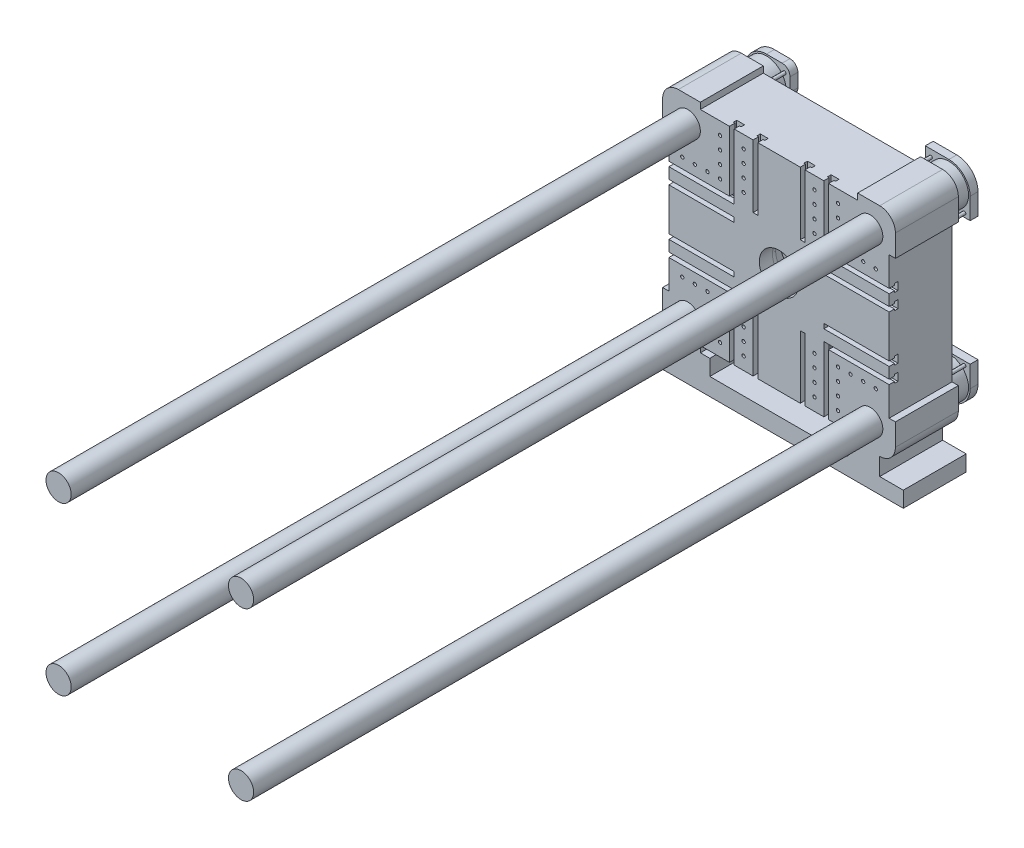
from build123d import *

# Parameters (mm, degrees)
SKETCH1_W                        = 1400
SKETCH1_H                        = 1300
BOSS_EXTRUDE1_DEPTH              = 400
SKETCH2_R                        = 80
BOSS_EXTRUDE2_DEPTH              = 4000
BOSS_EXTRUDE3_DEPTH              = 400
FILLET1_R                        = 100
FILLET1_OF_MIRROR1_R             = 100
MIRROR2_DEPTH                    = 400
SKETCH5_R                        = 125
CUT_EXTRUDE1_DEPTH               = 100
FILLET2_R                        = 50
CUT_EXTRUDE2_DEPTH               = 400
MIRROR4_COPY_1_DEPTH             = 400
CUT_EXTRUDE3_REACH               = 4682.78
FILLET3_R                        = 10
CUT_EXTRUDE4_DEPTH               = 415
CUT_EXTRUDE5_START               = -415
CUT_EXTRUDE5_DEPTH               = 415
CIRPATTERN1_COUNT                = 2
CIRPATTERN1_START                = -415
CIRPATTERN1_COPY_1_DEPTH         = 415
M24X3_0_TAPPED_HOLE1_AT_2_COUNT  = 2
M24X3_0_TAPPED_HOLE1_AT_2_PITCH  = 80
M24X3_0_TAPPED_HOLE1_AT_3_COUNT  = 2
M24X3_0_TAPPED_HOLE1_AT_3_PITCH  = 160
M24X3_0_TAPPED_HOLE1_AT_4_COUNT  = 2
M24X3_0_TAPPED_HOLE1_AT_4_PITCH  = 240
M24X3_0_TAPPED_HOLE1_AT_5_COUNT  = 2
M24X3_0_TAPPED_HOLE1_AT_5_PITCH  = 283.019433962
M24X3_0_TAPPED_HOLE1_AT_6_COUNT  = 2
M24X3_0_TAPPED_HOLE1_AT_6_PITCH  = 219.317121995
M24X3_0_TAPPED_HOLE1_AT_7_COUNT  = 2
M24X3_0_TAPPED_HOLE1_AT_7_PITCH  = 170
M24X3_0_TAPPED_HOLE1_AT_8_COUNT  = 2
M24X3_0_TAPPED_HOLE1_AT_8_PITCH  = 150
M24X3_0_TAPPED_HOLE1_AT_9_COUNT  = 2
M24X3_0_TAPPED_HOLE1_AT_9_PITCH  = 230
M24X3_0_TAPPED_HOLE1_AT_10_COUNT = 2
M24X3_0_TAPPED_HOLE1_AT_10_PITCH = 310
M24X3_0_TAPPED_HOLE1_AT_11_COUNT = 2
M24X3_0_TAPPED_HOLE1_AT_11_PITCH = 390
SKETCH15_R                       = 80
CUT_EXTRUDE6_DEPTH               = 5025
SKETCH16_R                       = 80
BOSS_EXTRUDE4_DEPTH              = 4000
BOSS_EXTRUDE4_2_DEPTH            = 4000
BOSS_EXTRUDE4_3_DEPTH            = 4000
BOSS_EXTRUDE4_4_DEPTH            = 4000
SKETCH17_R                       = 125
BOSS_EXTRUDE5_DEPTH              = 100
BOSS_EXTRUDE6_DEPTH              = 50
FILLET4_R                        = 50
SKETCH19_R                       = 10
BOSS_EXTRUDE7_DEPTH              = 222
MIRROR25_COPY_1_DEPTH            = 50
MIRROR25_COPY_2_SKETCH_R         = 10
MIRROR25_COPY_2_DEPTH            = 222
SKETCH20_W                       = 1280
SKETCH20_H                       = 400
BOSS_EXTRUDE8_DEPTH              = 211
SKETCH21_W                       = 880
SKETCH21_H                       = 100
CUT_EXTRUDE7_DEPTH               = 7314
SKETCH22_W                       = 150
SKETCH22_H                       = 100
BOSS_EXTRUDE9_DEPTH              = 400


# Read off the part's stored shape, not the designer's step: Mirror2
with BuildPart() as part:
    # Sketch1 → Boss-Extrude1 (new body)
    with BuildSketch(Plane.XY):
        Rectangle(SKETCH1_W, SKETCH1_H)
    extrude(amount=BOSS_EXTRUDE1_DEPTH)

    # Sketch2 → Boss-Extrude2 (add)
    with BuildSketch(Plane.XY.offset(400)):
        with Locations(Location((-550, 450, 0), (0, 0, 180))):
            Circle(SKETCH2_R)
        with Locations(Location((550, 450, 0), (0, 0, 180))):
            Circle(SKETCH2_R)
        with Locations(Location((550, -450, 0), (0, 0, 180))):
            Circle(SKETCH2_R)
        with Locations(Location((-550, -450, 0), (0, 0, 180))):
            Circle(SKETCH2_R)
    extrude(amount=BOSS_EXTRUDE2_DEPTH)

    # Sketch3 → Boss-Extrude3 (add)
    with BuildSketch(Plane(origin=(0, 0, 0), x_dir=(-1, 0, 0), z_dir=(0, 0, -1))):
        Polygon((-700, 650), (-500, 650), (-500, 690), (-740, 690), (-740, 450), (-700, 450), align=None)
    boss_extrude3 = extrude(amount=-BOSS_EXTRUDE3_DEPTH)

    # Fillet1
    fillet1_edges = [part.edges().sort_by_distance(p)[0] for p in [
        (740, 690, 200),
    ]]
    fillet(fillet1_edges, radius=FILLET1_R)

    # Mirror1: Boss-Extrude3 across plane
    add(boss_extrude3.mirror(Plane(origin=(0, 0, 0), x_dir=(0, 0, 1), z_dir=(1, 0, 0))))

    # Fillet1 of Mirror1
    fillet1_of_mirror1_edges = [part.edges().sort_by_distance(p)[0] for p in [
        (-740, 690, 200),
    ]]
    fillet(fillet1_of_mirror1_edges, radius=FILLET1_OF_MIRROR1_R)

    # Mirror2 outline → Mirror2 (add)
    with BuildSketch(Plane.XY):
        with BuildLine():
            Line((-500, -690), (-500, -650))
            Line((-500, -650), (-700, -650))
            Line((-700, -650), (-700, -450))
            Line((-700, -450), (-740, -450))
            Line((-740, -450), (-740, -590))
            ThreePointArc((-740, -590), (-710.710678119, -660.710678119), (-640, -690))
            Line((-640, -690), (-500, -690))
        make_face()
        with BuildLine():
            Line((740, -590), (740, -450))
            Line((740, -450), (700, -450))
            Line((700, -450), (700, -650))
            Line((700, -650), (500, -650))
            Line((500, -650), (500, -690))
            Line((500, -690), (640, -690))
            ThreePointArc((640, -690), (710.710678119, -660.710678119), (740, -590))
        make_face()
    extrude(amount=MIRROR2_DEPTH)

    # Sketch5 → Cut-Extrude1 (cut)
    with BuildSketch(Plane.XY.offset(400)):
        Circle(SKETCH5_R)
    extrude(amount=-CUT_EXTRUDE1_DEPTH, mode=Mode.SUBTRACT)

    # Sketch6 → Cut-Revolve1 (revolve, cut)
    with BuildSketch(Plane(origin=(0, 0, 0), x_dir=(1, 0, 0), z_dir=(0, 1, 0))):
        Polygon((0, -300), (0, 0), (200, 0), (200, -200), (125, -300), align=None)
    revolve(axis=Axis((0, 0, 300), (0, 0, -1)), mode=Mode.SUBTRACT)

    # Fillet2
    fillet2_edges = [part.edges().sort_by_distance(p)[0] for p in [
        (-125, 0, 300),
    ]]
    fillet(fillet2_edges, radius=FILLET2_R)

    # Sketch7 → Cut-Extrude2 (cut)
    with BuildSketch(Plane.XZ.offset(650)):
        Polygon((275, 344), (325, 344), (325, 366), (315, 366), (315, 400), (285, 400), (285, 366), (275, 366), align=None)
        Polygon((125, 344), (175, 344), (175, 366), (165, 366), (165, 400), (135, 400), (135, 366), (125, 366), align=None)
    cut_extrude2 = extrude(amount=-CUT_EXTRUDE2_DEPTH, mode=Mode.SUBTRACT)

    # Mirror3: Cut-Extrude2 across plane
    add(cut_extrude2.mirror(Plane(origin=(0, 0, 0), x_dir=(0, 0, 1), z_dir=(1, 0, 0))), mode=Mode.SUBTRACT)

    # Mirror4: Cut-Extrude2 across plane
    add(cut_extrude2.mirror(Plane.ZX), mode=Mode.SUBTRACT)

    # Mirror4 copy 1 sketch → Mirror4 copy 1 (cut)
    with BuildSketch(Plane(origin=(0, 650, 0), x_dir=(-1, 0, 0), z_dir=(0, 1, 0))):
        Polygon((275, 344), (325, 344), (325, 366), (315, 366), (315, 400), (285, 400), (285, 366), (275, 366), align=None)
        Polygon((125, 344), (175, 344), (175, 366), (165, 366), (165, 400), (135, 400), (135, 366), (125, 366), align=None)
    extrude(amount=-MIRROR4_COPY_1_DEPTH, mode=Mode.SUBTRACT)

    # Cut-Extrude3: up to this face of the body (flat: up to its plane)
    cut_extrude3_end = Plane(part.part.faces().sort_by_distance((285, 450, 383))[0])
    # Sketch8 → Cut-Extrude3 (cut, up to the picked face)
    with BuildSketch(Plane(origin=(700, 0, 0), x_dir=(0, 0, -1), z_dir=(1, 0, 0)), mode=Mode.PRIVATE) as cut_extrude3_sk1:
        Polygon((-344, 275), (-344, 225), (-366, 225), (-366, 235), (-400, 235), (-400, 265), (-366, 265), (-366, 275), align=None)
    cut_extrude3_tool1 = split(extrude(cut_extrude3_sk1.sketch, amount=-CUT_EXTRUDE3_REACH, mode=Mode.PRIVATE), bisect_by=cut_extrude3_end, keep=Keep.BOTH, mode=Mode.PRIVATE)
    cut_extrude3 = cut_extrude3_tool1.solids().sort_by(Axis((700, 250, 368.471698), (-1, 0, 0)))[0]
    add(cut_extrude3, mode=Mode.SUBTRACT)

    # Fillet3
    fillet3_edges = [part.edges().sort_by_distance(p)[0] for p in [
        (315, 265, 383),
        (285, 235, 383),
    ]]
    fillet(fillet3_edges, radius=FILLET3_R)

    # Mirror5: Cut-Extrude3 across plane
    add(cut_extrude3.mirror(Plane.ZX), mode=Mode.SUBTRACT)

    # Sketch9 → Cut-Extrude4 (cut)
    with BuildSketch(Plane.ZY.offset(700)):
        Polygon((400, 265), (366, 265), (366, 275), (344, 275), (344, 225), (366, 225), (366, 235), (400, 235), align=None)
    cut_extrude4 = extrude(amount=-CUT_EXTRUDE4_DEPTH, mode=Mode.SUBTRACT)

    # Mirror12: Cut-Extrude4 across plane
    add(cut_extrude4.mirror(Plane.ZX), mode=Mode.SUBTRACT)

    # Sketch10 → Cut-Extrude5 (cut)
    with BuildSketch(Plane(origin=(700, 0, 0), x_dir=(0, 0, -1), z_dir=(1, 0, 0)).offset(CUT_EXTRUDE5_START)):
        Polygon((-344, 175), (-344, 125), (-366, 125), (-366, 135), (-400, 135), (-400, 165), (-366, 165), (-366, 175), align=None)
    cut_extrude5 = extrude(amount=CUT_EXTRUDE5_DEPTH, mode=Mode.SUBTRACT)

    # Mirror13: Cut-Extrude5 across plane
    add(cut_extrude5.mirror(Plane.ZX), mode=Mode.SUBTRACT)

    # CirPattern1: Cut-Extrude5 ×2 about axis
    cirpattern1_axis = Axis((0, 0, 0), (0, 0, 1))
    for i in range(1, CIRPATTERN1_COUNT):
        add(cut_extrude5.rotate(cirpattern1_axis, i * 360 / CIRPATTERN1_COUNT), mode=Mode.SUBTRACT)

    # CirPattern1 copy 1 sketch → CirPattern1 copy 1 (cut)
    with BuildSketch(Plane(origin=(-700, 0, 0), x_dir=(0, 0, -1), z_dir=(-1, 0, 0)).offset(CIRPATTERN1_START)):
        Polygon((-344, -175), (-344, -125), (-366, -125), (-366, -135), (-400, -135), (-400, -165), (-366, -165), (-366, -175), align=None)
    extrude(amount=CIRPATTERN1_COPY_1_DEPTH, mode=Mode.SUBTRACT)

    # Sketch14 → M24x3.0 Tapped Hole1 (revolve, cut)
    with BuildSketch(Plane(origin=(225, -330, 400), x_dir=(0, -1, 0), z_dir=(1, 0, 0))):
        Polygon((0, 0), (0, 66.3090365), (10.5, 60), (10.5, 0), align=None)
    m24x3_0_tapped_hole1 = revolve(axis=Axis((225, -330, 406.35), (0, 0, -1)), mode=Mode.SUBTRACT)

    # M24x3.0 Tapped Hole1 at 2: M24x3.0 Tapped Hole1 ×2
    with Locations(*[(0, -i * M24X3_0_TAPPED_HOLE1_AT_2_PITCH, 0) for i in range(1, M24X3_0_TAPPED_HOLE1_AT_2_COUNT)]):
        add(m24x3_0_tapped_hole1, mode=Mode.SUBTRACT)

    # M24x3.0 Tapped Hole1 at 3: M24x3.0 Tapped Hole1 ×2
    with Locations(*[(0, -i * M24X3_0_TAPPED_HOLE1_AT_3_PITCH, 0) for i in range(1, M24X3_0_TAPPED_HOLE1_AT_3_COUNT)]):
        add(m24x3_0_tapped_hole1, mode=Mode.SUBTRACT)

    # M24x3.0 Tapped Hole1 at 4: M24x3.0 Tapped Hole1 ×2
    with Locations(*[(0, -i * M24X3_0_TAPPED_HOLE1_AT_4_PITCH, 0) for i in range(1, M24X3_0_TAPPED_HOLE1_AT_4_COUNT)]):
        add(m24x3_0_tapped_hole1, mode=Mode.SUBTRACT)

    # M24x3.0 Tapped Hole1 at 5: M24x3.0 Tapped Hole1 ×2
    with Locations(*[Vector(0.5299989400031799, -0.8479983040050881, 0) * (i * M24X3_0_TAPPED_HOLE1_AT_5_PITCH) for i in range(1, M24X3_0_TAPPED_HOLE1_AT_5_COUNT)]):
        add(m24x3_0_tapped_hole1, mode=Mode.SUBTRACT)

    # M24x3.0 Tapped Hole1 at 6: M24x3.0 Tapped Hole1 ×2
    with Locations(*[Vector(0.6839411288813297, -0.7295372041400852, 0) * (i * M24X3_0_TAPPED_HOLE1_AT_6_PITCH) for i in range(1, M24X3_0_TAPPED_HOLE1_AT_6_COUNT)]):
        add(m24x3_0_tapped_hole1, mode=Mode.SUBTRACT)

    # M24x3.0 Tapped Hole1 at 7: M24x3.0 Tapped Hole1 ×2
    with Locations(*[Vector(0.8823529411764706, -0.47058823529411786, 0) * (i * M24X3_0_TAPPED_HOLE1_AT_7_PITCH) for i in range(1, M24X3_0_TAPPED_HOLE1_AT_7_COUNT)]):
        add(m24x3_0_tapped_hole1, mode=Mode.SUBTRACT)

    # M24x3.0 Tapped Hole1 at 8: M24x3.0 Tapped Hole1 ×2
    with Locations(*[(i * M24X3_0_TAPPED_HOLE1_AT_8_PITCH, 0, 0) for i in range(1, M24X3_0_TAPPED_HOLE1_AT_8_COUNT)]):
        add(m24x3_0_tapped_hole1, mode=Mode.SUBTRACT)

    # M24x3.0 Tapped Hole1 at 9: M24x3.0 Tapped Hole1 ×2
    with Locations(*[(i * M24X3_0_TAPPED_HOLE1_AT_9_PITCH, 0, 0) for i in range(1, M24X3_0_TAPPED_HOLE1_AT_9_COUNT)]):
        add(m24x3_0_tapped_hole1, mode=Mode.SUBTRACT)

    # M24x3.0 Tapped Hole1 at 10: M24x3.0 Tapped Hole1 ×2
    with Locations(*[(i * M24X3_0_TAPPED_HOLE1_AT_10_PITCH, 0, 0) for i in range(1, M24X3_0_TAPPED_HOLE1_AT_10_COUNT)]):
        add(m24x3_0_tapped_hole1, mode=Mode.SUBTRACT)

    # M24x3.0 Tapped Hole1 at 11: M24x3.0 Tapped Hole1 ×2
    with Locations(*[(i * M24X3_0_TAPPED_HOLE1_AT_11_PITCH, 0, 0) for i in range(1, M24X3_0_TAPPED_HOLE1_AT_11_COUNT)]):
        add(m24x3_0_tapped_hole1, mode=Mode.SUBTRACT)

    # Mirror22: M24x3.0 Tapped Hole1 across plane
    add(m24x3_0_tapped_hole1.mirror(Plane.ZX), mode=Mode.SUBTRACT)

    # Mirror22 copy 1 sketch → Mirror22 copy 1 (revolve, cut)
    with BuildSketch(Plane(origin=(225, 410, 400), x_dir=(0, 1, 0), z_dir=(1, 0, 0))):
        Polygon((0, 0), (0, -66.3090365), (10.5, -60), (10.5, 0), align=None)
    revolve(axis=Axis((225, 410, 406.35), (0, 0, 1)), mode=Mode.SUBTRACT)

    # Mirror22 copy 2 sketch → Mirror22 copy 2 (revolve, cut)
    with BuildSketch(Plane(origin=(225, 490, 400), x_dir=(0, 1, 0), z_dir=(1, 0, 0))):
        Polygon((0, 0), (0, -66.3090365), (10.5, -60), (10.5, 0), align=None)
    revolve(axis=Axis((225, 490, 406.35), (0, 0, 1)), mode=Mode.SUBTRACT)

    # Mirror22 copy 3 sketch → Mirror22 copy 3 (revolve, cut)
    with BuildSketch(Plane(origin=(225, 570, 400), x_dir=(0, 1, 0), z_dir=(1, 0, 0))):
        Polygon((0, 0), (0, -66.3090365), (10.5, -60), (10.5, 0), align=None)
    revolve(axis=Axis((225, 570, 406.35), (0, 0, 1)), mode=Mode.SUBTRACT)

    # Mirror22 copy 4 sketch → Mirror22 copy 4 (revolve, cut)
    with BuildSketch(Plane(origin=(375, 570, 400), x_dir=(0, 1, 0), z_dir=(1, 0, 0))):
        Polygon((0, 0), (0, -66.3090365), (10.5, -60), (10.5, 0), align=None)
    revolve(axis=Axis((375, 570, 406.35), (0, 0, 1)), mode=Mode.SUBTRACT)

    # Mirror22 copy 5 sketch → Mirror22 copy 5 (revolve, cut)
    with BuildSketch(Plane(origin=(375, 490, 400), x_dir=(0, 1, 0), z_dir=(1, 0, 0))):
        Polygon((0, 0), (0, -66.3090365), (10.5, -60), (10.5, 0), align=None)
    revolve(axis=Axis((375, 490, 406.35), (0, 0, 1)), mode=Mode.SUBTRACT)

    # Mirror22 copy 6 sketch → Mirror22 copy 6 (revolve, cut)
    with BuildSketch(Plane(origin=(375, 410, 400), x_dir=(0, 1, 0), z_dir=(1, 0, 0))):
        Polygon((0, 0), (0, -66.3090365), (10.5, -60), (10.5, 0), align=None)
    revolve(axis=Axis((375, 410, 406.35), (0, 0, 1)), mode=Mode.SUBTRACT)

    # Mirror22 copy 7 sketch → Mirror22 copy 7 (revolve, cut)
    with BuildSketch(Plane(origin=(375, 330, 400), x_dir=(0, 1, 0), z_dir=(1, 0, 0))):
        Polygon((0, 0), (0, -66.3090365), (10.5, -60), (10.5, 0), align=None)
    revolve(axis=Axis((375, 330, 406.35), (0, 0, 1)), mode=Mode.SUBTRACT)

    # Mirror22 copy 8 sketch → Mirror22 copy 8 (revolve, cut)
    with BuildSketch(Plane(origin=(455, 330, 400), x_dir=(0, 1, 0), z_dir=(1, 0, 0))):
        Polygon((0, 0), (0, -66.3090365), (10.5, -60), (10.5, 0), align=None)
    revolve(axis=Axis((455, 330, 406.35), (0, 0, 1)), mode=Mode.SUBTRACT)

    # Mirror22 copy 9 sketch → Mirror22 copy 9 (revolve, cut)
    with BuildSketch(Plane(origin=(535, 330, 400), x_dir=(0, 1, 0), z_dir=(1, 0, 0))):
        Polygon((0, 0), (0, -66.3090365), (10.5, -60), (10.5, 0), align=None)
    revolve(axis=Axis((535, 330, 406.35), (0, 0, 1)), mode=Mode.SUBTRACT)

    # Mirror22 copy 10 sketch → Mirror22 copy 10 (revolve, cut)
    with BuildSketch(Plane(origin=(615, 330, 400), x_dir=(0, 1, 0), z_dir=(1, 0, 0))):
        Polygon((0, 0), (0, -66.3090365), (10.5, -60), (10.5, 0), align=None)
    revolve(axis=Axis((615, 330, 406.35), (0, 0, 1)), mode=Mode.SUBTRACT)

    # Mirror23: M24x3.0 Tapped Hole1 across plane
    add(m24x3_0_tapped_hole1.mirror(Plane(origin=(0, 0, 0), x_dir=(0, 0, 1), z_dir=(1, 0, 0))), mode=Mode.SUBTRACT)

    # Mirror23 copy 1 sketch → Mirror23 copy 1 (revolve, cut)
    with BuildSketch(Plane(origin=(-225, -410, 400), x_dir=(0, -1, 0), z_dir=(-1, 0, 0))):
        Polygon((0, 0), (0, -66.3090365), (10.5, -60), (10.5, 0), align=None)
    revolve(axis=Axis((-225, -410, 406.35), (0, 0, 1)), mode=Mode.SUBTRACT)

    # Mirror23 copy 2 sketch → Mirror23 copy 2 (revolve, cut)
    with BuildSketch(Plane(origin=(-225, -490, 400), x_dir=(0, -1, 0), z_dir=(-1, 0, 0))):
        Polygon((0, 0), (0, -66.3090365), (10.5, -60), (10.5, 0), align=None)
    revolve(axis=Axis((-225, -490, 406.35), (0, 0, 1)), mode=Mode.SUBTRACT)

    # Mirror23 copy 3 sketch → Mirror23 copy 3 (revolve, cut)
    with BuildSketch(Plane(origin=(-225, -570, 400), x_dir=(0, -1, 0), z_dir=(-1, 0, 0))):
        Polygon((0, 0), (0, -66.3090365), (10.5, -60), (10.5, 0), align=None)
    revolve(axis=Axis((-225, -570, 406.35), (0, 0, 1)), mode=Mode.SUBTRACT)

    # Mirror23 copy 4 sketch → Mirror23 copy 4 (revolve, cut)
    with BuildSketch(Plane(origin=(-375, -570, 400), x_dir=(0, -1, 0), z_dir=(-1, 0, 0))):
        Polygon((0, 0), (0, -66.3090365), (10.5, -60), (10.5, 0), align=None)
    revolve(axis=Axis((-375, -570, 406.35), (0, 0, 1)), mode=Mode.SUBTRACT)

    # Mirror23 copy 5 sketch → Mirror23 copy 5 (revolve, cut)
    with BuildSketch(Plane(origin=(-375, -490, 400), x_dir=(0, -1, 0), z_dir=(-1, 0, 0))):
        Polygon((0, 0), (0, -66.3090365), (10.5, -60), (10.5, 0), align=None)
    revolve(axis=Axis((-375, -490, 406.35), (0, 0, 1)), mode=Mode.SUBTRACT)

    # Mirror23 copy 6 sketch → Mirror23 copy 6 (revolve, cut)
    with BuildSketch(Plane(origin=(-375, -410, 400), x_dir=(0, -1, 0), z_dir=(-1, 0, 0))):
        Polygon((0, 0), (0, -66.3090365), (10.5, -60), (10.5, 0), align=None)
    revolve(axis=Axis((-375, -410, 406.35), (0, 0, 1)), mode=Mode.SUBTRACT)

    # Mirror23 copy 7 sketch → Mirror23 copy 7 (revolve, cut)
    with BuildSketch(Plane(origin=(-375, -330, 400), x_dir=(0, -1, 0), z_dir=(-1, 0, 0))):
        Polygon((0, 0), (0, -66.3090365), (10.5, -60), (10.5, 0), align=None)
    revolve(axis=Axis((-375, -330, 406.35), (0, 0, 1)), mode=Mode.SUBTRACT)

    # Mirror23 copy 8 sketch → Mirror23 copy 8 (revolve, cut)
    with BuildSketch(Plane(origin=(-455, -330, 400), x_dir=(0, -1, 0), z_dir=(-1, 0, 0))):
        Polygon((0, 0), (0, -66.3090365), (10.5, -60), (10.5, 0), align=None)
    revolve(axis=Axis((-455, -330, 406.35), (0, 0, 1)), mode=Mode.SUBTRACT)

    # Mirror23 copy 9 sketch → Mirror23 copy 9 (revolve, cut)
    with BuildSketch(Plane(origin=(-535, -330, 400), x_dir=(0, -1, 0), z_dir=(-1, 0, 0))):
        Polygon((0, 0), (0, -66.3090365), (10.5, -60), (10.5, 0), align=None)
    revolve(axis=Axis((-535, -330, 406.35), (0, 0, 1)), mode=Mode.SUBTRACT)

    # Mirror23 copy 10 sketch → Mirror23 copy 10 (revolve, cut)
    with BuildSketch(Plane(origin=(-615, -330, 400), x_dir=(0, -1, 0), z_dir=(-1, 0, 0))):
        Polygon((0, 0), (0, -66.3090365), (10.5, -60), (10.5, 0), align=None)
    revolve(axis=Axis((-615, -330, 406.35), (0, 0, 1)), mode=Mode.SUBTRACT)

    # Mirror23 copy 11 sketch → Mirror23 copy 11 (revolve, cut)
    with BuildSketch(Plane(origin=(-225, 330, 400), x_dir=(0, 1, 0), z_dir=(-1, 0, 0))):
        Polygon((0, 0), (0, 66.3090365), (10.5, 60), (10.5, 0), align=None)
    revolve(axis=Axis((-225, 330, 406.35), (0, 0, -1)), mode=Mode.SUBTRACT)

    # Mirror23 copy 12 sketch → Mirror23 copy 12 (revolve, cut)
    with BuildSketch(Plane(origin=(-225, 410, 400), x_dir=(0, 1, 0), z_dir=(-1, 0, 0))):
        Polygon((0, 0), (0, 66.3090365), (10.5, 60), (10.5, 0), align=None)
    revolve(axis=Axis((-225, 410, 406.35), (0, 0, -1)), mode=Mode.SUBTRACT)

    # Mirror23 copy 13 sketch → Mirror23 copy 13 (revolve, cut)
    with BuildSketch(Plane(origin=(-225, 490, 400), x_dir=(0, 1, 0), z_dir=(-1, 0, 0))):
        Polygon((0, 0), (0, 66.3090365), (10.5, 60), (10.5, 0), align=None)
    revolve(axis=Axis((-225, 490, 406.35), (0, 0, -1)), mode=Mode.SUBTRACT)

    # Mirror23 copy 14 sketch → Mirror23 copy 14 (revolve, cut)
    with BuildSketch(Plane(origin=(-225, 570, 400), x_dir=(0, 1, 0), z_dir=(-1, 0, 0))):
        Polygon((0, 0), (0, 66.3090365), (10.5, 60), (10.5, 0), align=None)
    revolve(axis=Axis((-225, 570, 406.35), (0, 0, -1)), mode=Mode.SUBTRACT)

    # Mirror23 copy 15 sketch → Mirror23 copy 15 (revolve, cut)
    with BuildSketch(Plane(origin=(-375, 570, 400), x_dir=(0, 1, 0), z_dir=(-1, 0, 0))):
        Polygon((0, 0), (0, 66.3090365), (10.5, 60), (10.5, 0), align=None)
    revolve(axis=Axis((-375, 570, 406.35), (0, 0, -1)), mode=Mode.SUBTRACT)

    # Mirror23 copy 16 sketch → Mirror23 copy 16 (revolve, cut)
    with BuildSketch(Plane(origin=(-375, 490, 400), x_dir=(0, 1, 0), z_dir=(-1, 0, 0))):
        Polygon((0, 0), (0, 66.3090365), (10.5, 60), (10.5, 0), align=None)
    revolve(axis=Axis((-375, 490, 406.35), (0, 0, -1)), mode=Mode.SUBTRACT)

    # Mirror23 copy 17 sketch → Mirror23 copy 17 (revolve, cut)
    with BuildSketch(Plane(origin=(-375, 410, 400), x_dir=(0, 1, 0), z_dir=(-1, 0, 0))):
        Polygon((0, 0), (0, 66.3090365), (10.5, 60), (10.5, 0), align=None)
    revolve(axis=Axis((-375, 410, 406.35), (0, 0, -1)), mode=Mode.SUBTRACT)

    # Mirror23 copy 18 sketch → Mirror23 copy 18 (revolve, cut)
    with BuildSketch(Plane(origin=(-375, 330, 400), x_dir=(0, 1, 0), z_dir=(-1, 0, 0))):
        Polygon((0, 0), (0, 66.3090365), (10.5, 60), (10.5, 0), align=None)
    revolve(axis=Axis((-375, 330, 406.35), (0, 0, -1)), mode=Mode.SUBTRACT)

    # Mirror23 copy 19 sketch → Mirror23 copy 19 (revolve, cut)
    with BuildSketch(Plane(origin=(-455, 330, 400), x_dir=(0, 1, 0), z_dir=(-1, 0, 0))):
        Polygon((0, 0), (0, 66.3090365), (10.5, 60), (10.5, 0), align=None)
    revolve(axis=Axis((-455, 330, 406.35), (0, 0, -1)), mode=Mode.SUBTRACT)

    # Mirror23 copy 20 sketch → Mirror23 copy 20 (revolve, cut)
    with BuildSketch(Plane(origin=(-535, 330, 400), x_dir=(0, 1, 0), z_dir=(-1, 0, 0))):
        Polygon((0, 0), (0, 66.3090365), (10.5, 60), (10.5, 0), align=None)
    revolve(axis=Axis((-535, 330, 406.35), (0, 0, -1)), mode=Mode.SUBTRACT)

    # Mirror23 copy 21 sketch → Mirror23 copy 21 (revolve, cut)
    with BuildSketch(Plane(origin=(-615, 330, 400), x_dir=(0, 1, 0), z_dir=(-1, 0, 0))):
        Polygon((0, 0), (0, 66.3090365), (10.5, 60), (10.5, 0), align=None)
    revolve(axis=Axis((-615, 330, 406.35), (0, 0, -1)), mode=Mode.SUBTRACT)

    # Sketch15 → Cut-Extrude6 (cut)
    with BuildSketch(Plane.XY.offset(400)):
        with Locations((-550, 450)):
            Circle(SKETCH15_R)
        with Locations((550, 450)):
            Circle(SKETCH15_R)
        with Locations((550, -450)):
            Circle(SKETCH15_R)
        with Locations((-550, -450)):
            Circle(SKETCH15_R)
    extrude(amount=CUT_EXTRUDE6_DEPTH, mode=Mode.SUBTRACT)

    # Sketch17 → Boss-Extrude5 (add)
    with BuildSketch(Plane(origin=(0, 0, 0), x_dir=(-1, 0, 0), z_dir=(0, 0, -1))):
        with Locations((-580, 530)):
            Circle(SKETCH17_R)
        with Locations((580, 530)):
            Circle(SKETCH17_R)
        with Locations((580, -530)):
            Circle(SKETCH17_R)
        with Locations((-580, -530)):
            Circle(SKETCH17_R)
    extrude(amount=BOSS_EXTRUDE5_DEPTH)

    # Sketch18 → Boss-Extrude6 (add)
    with BuildSketch(Plane(origin=(0, 0, -100), x_dir=(-1, 0, 0), z_dir=(0, 0, -1))):
        with BuildLine():
            Line((430, 515), (505, 395))
            Line((505, 395), (580, 395))
            Line((580, 395), (715, 395))
            Line((715, 395), (715, 530))
            ThreePointArc((715, 530), (675.45941546, 625.45941546), (580, 665))
            Line((580, 665), (430, 665))
            Line((430, 665), (430, 515))
        make_face()
    boss_extrude6 = extrude(amount=BOSS_EXTRUDE6_DEPTH)

    # Fillet4
    fillet4_edges = [part.edges().sort_by_distance(p)[0] for p in [
        (-505, 395, -125),
        (-715, 395, -125),
        (-430, 665, -125),
        (-430, 515, -125),
    ]]
    fillet(fillet4_edges, radius=FILLET4_R)

    # Sketch19 → Boss-Extrude7 (add)
    with BuildSketch(Plane(origin=(0, 0, -150), x_dir=(-1, 0, 0), z_dir=(0, 0, -1))):
        with Locations((465, 620)):
            Circle(SKETCH19_R)
        with Locations((678, 420)):
            Circle(SKETCH19_R)
    boss_extrude7 = extrude(amount=-BOSS_EXTRUDE7_DEPTH)

    # Mirror24: Boss-Extrude6, Boss-Extrude7 across plane
    add(boss_extrude6.mirror(Plane(origin=(0, 0, 0), x_dir=(0, 0, 1), z_dir=(1, 0, 0))))
    add(boss_extrude7.mirror(Plane(origin=(0, 0, 0), x_dir=(0, 0, 1), z_dir=(1, 0, 0))))

    # Mirror25: Boss-Extrude6, Boss-Extrude7 across plane
    add(boss_extrude6.mirror(Plane.ZX))
    add(boss_extrude7.mirror(Plane.ZX))

    # Mirror25 copy 1 sketch → Mirror25 copy 1 (add)
    with BuildSketch(Plane(origin=(0, 0, -100), x_dir=(1, 0, 0), z_dir=(0, 0, -1))):
        with BuildLine():
            Line((430, 515), (505, 395))
            Line((505, 395), (580, 395))
            Line((580, 395), (715, 395))
            Line((715, 395), (715, 530))
            ThreePointArc((715, 530), (675.45941546, 625.45941546), (580, 665))
            Line((580, 665), (430, 665))
            Line((430, 665), (430, 515))
        make_face()
    extrude(amount=MIRROR25_COPY_1_DEPTH)

    # Mirror25 copy 2 sketch → Mirror25 copy 2 (add)
    with BuildSketch(Plane(origin=(0, 0, -150), x_dir=(1, 0, 0), z_dir=(0, 0, -1))):
        with Locations((465, 620)):
            Circle(MIRROR25_COPY_2_SKETCH_R)
        with Locations((678, 420)):
            Circle(MIRROR25_COPY_2_SKETCH_R)
    extrude(amount=-MIRROR25_COPY_2_DEPTH)

    # Sketch20 → Boss-Extrude8 (add)
    with BuildSketch(Plane.XZ.offset(690)):
        with Locations((0, 200)):
            Rectangle(SKETCH20_W, SKETCH20_H)
    extrude(amount=BOSS_EXTRUDE8_DEPTH)

    # Sketch21 → Cut-Extrude7 (cut)
    with BuildSketch(Plane.XY.offset(400)):
        with Locations((0, -740)):
            Rectangle(SKETCH21_W, SKETCH21_H)
    extrude(amount=-CUT_EXTRUDE7_DEPTH, mode=Mode.SUBTRACT)

    # Sketch22 → Boss-Extrude9 (add)
    with BuildSketch(Plane.XY.offset(400)):
        with Locations((-715, -851)):
            Rectangle(SKETCH22_W, SKETCH22_H)
        with Locations((715, -851)):
            Rectangle(SKETCH22_W, SKETCH22_H)
    extrude(amount=-BOSS_EXTRUDE9_DEPTH)


with BuildPart() as body_2:
    # Sketch16 → Boss-Extrude4 (new body)
    with BuildSketch(Plane.XY.offset(400)):
        with Locations((-580, 530)):
            Circle(SKETCH16_R)
    extrude(amount=BOSS_EXTRUDE4_DEPTH)


with BuildPart() as body_3:
    # Sketch16 → Boss-Extrude4 2 (new body)
    with BuildSketch(Plane.XY.offset(400)):
        with Locations((580, 530)):
            Circle(SKETCH16_R)
    extrude(amount=BOSS_EXTRUDE4_2_DEPTH)


with BuildPart() as body_4:
    # Sketch16 → Boss-Extrude4 3 (new body)
    with BuildSketch(Plane.XY.offset(400)):
        with Locations(Location((580, -530, 0), (0, 0, 180))):
            Circle(SKETCH16_R)
    extrude(amount=BOSS_EXTRUDE4_3_DEPTH)


with BuildPart() as body_5:
    # Sketch16 → Boss-Extrude4 4 (new body)
    with BuildSketch(Plane.XY.offset(400)):
        with Locations(Location((-580, -530, 0), (0, 0, 180))):
            Circle(SKETCH16_R)
    extrude(amount=BOSS_EXTRUDE4_4_DEPTH)


solid = Compound([part.part, body_2.part, body_3.part, body_4.part, body_5.part])
